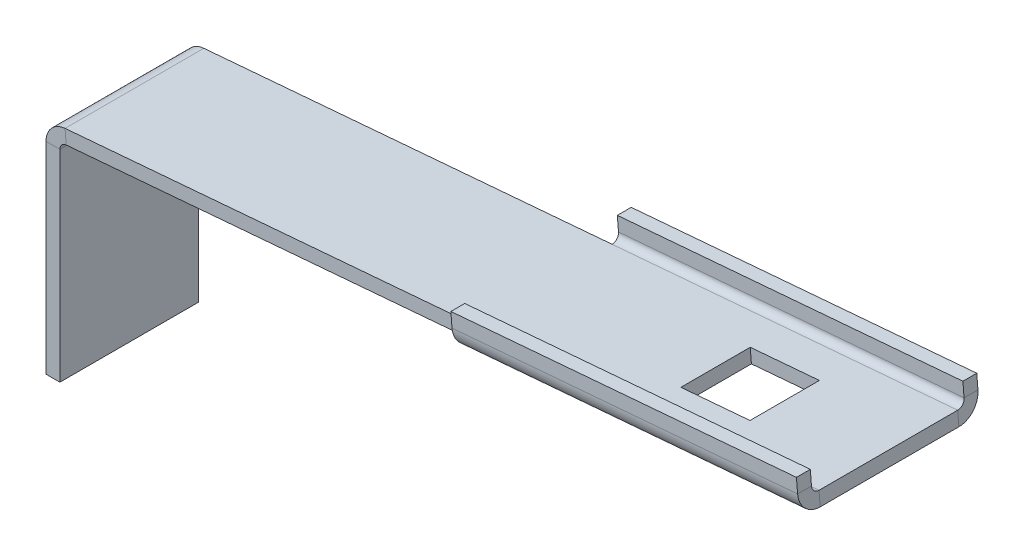
from build123d import *

# Parameters (mm, degrees)
SM_BASE_FLANGE_1_DEPTH      = 2
SM_EDGE_FLANGE_1_DEPTH      = 5
SM_EDGE_FLANGE_1_BEND_DEPTH = 5
SKETCH_16_W                 = 1
SKETCH_16_H                 = 1
CUT_EXTRUDE_3_DEPTH         = 0.3


# Sheet-metal steps are written as plain solids
with BuildPart() as part:
    # Эскиз5 → Базовая кромка1 (new body)
    with BuildSketch(Plane.XY):
        with BuildLine():
            Line((-8.670207128, -3.533537369), (-8.670207128, -0.625462256))
            ThreePointArc((-8.670207128, -0.625462256), (-8.643827777, -0.557786558), (-8.578607126, -0.52581568))
            Line((-8.578607126, -0.52581568), (2.29091619, 0.390462415))
            Line((2.29091619, 0.390462415), (2.274116194, 0.589755566))
            Line((2.274116194, 0.589755566), (-8.595407122, -0.326522529))
            ThreePointArc((-8.595407122, -0.326522529), (-8.791069074, -0.422435162), (-8.870207128, -0.625462256))
            Line((-8.870207128, -0.625462256), (-8.870207128, -3.533537369))
            Line((-8.870207128, -3.533537369), (-8.670207128, -3.533537369))
        make_face()
    extrude(amount=SM_BASE_FLANGE_1_DEPTH)

    # Ребро-кромка1 section (across the edge) → Ребро-кромка1 (add)
    with BuildSketch(Plane(origin=(-2.708212587, 0.169755664, 2.1), x_dir=(0, 0, -1), z_dir=(0.9964657562113037, 0.08399998034663243, 0))):
        with BuildLine():
            Line((-0.2, 0.1), (-0.2, 0.3))
            Line((-0.2, 0.3), (0, 0.3))
            Line((0, 0.3), (0, 0.1))
            ThreePointArc((0, 0.1), (0.029289322, 0.029289322), (0.1, 0))
            Line((0.1, 0), (0.1, -0.2))
            ThreePointArc((0.1, -0.2), (-0.112132034, -0.112132034), (-0.2, 0.1))
        make_face()
    extrude(amount=SM_EDGE_FLANGE_1_DEPTH)

    # Ребро-кромка1 section 2 (across the edge) → Ребро-кромка1 bend (add)
    with BuildSketch(Plane(origin=(2.274116194, 0.589755566, -0.1), x_dir=(0, 0, 1), z_dir=(-0.9964657562113037, -0.08399998034663243, 0))):
        with BuildLine():
            Line((-0.2, 0.1), (-0.2, 0.3))
            Line((-0.2, 0.3), (0, 0.3))
            Line((0, 0.3), (0, 0.1))
            ThreePointArc((0, 0.1), (0.029289322, 0.029289322), (0.1, 0))
            Line((0.1, 0), (0.1, -0.2))
            ThreePointArc((0.1, -0.2), (-0.112132034, -0.112132034), (-0.2, 0.1))
        make_face()
    extrude(amount=SM_EDGE_FLANGE_1_BEND_DEPTH)

    # Эскиз16 → Вырез-Вытянуть3 (cut)
    with BuildSketch(Plane(origin=(-0.033318215, 0.395243668, 0), x_dir=(0.9964657562113037, 0.08399998034663245, 0), z_dir=(-0.08399998034663245, 0.9964657562113038, 0))):
        with Locations((0.315618369, -1)):
            Rectangle(SKETCH_16_W, SKETCH_16_H)
    extrude(amount=-CUT_EXTRUDE_3_DEPTH, mode=Mode.SUBTRACT)


solid = part.part
